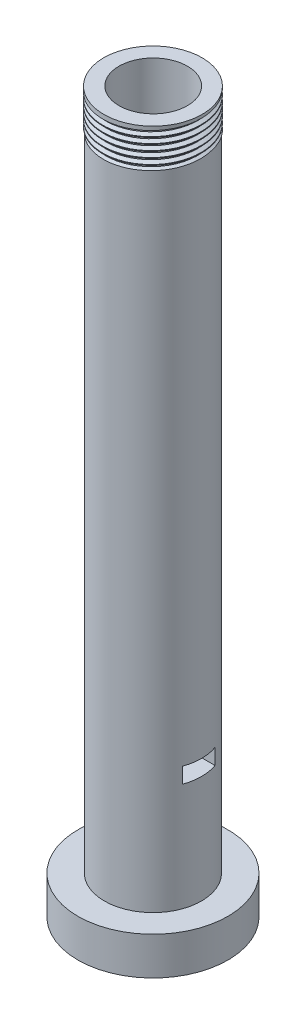
from build123d import *

# Parameters (mm, degrees)
SKETCH2_R                           = 8
CUT_EXTRUDE1_DEPTH                  = 134.061937
THREAD5_PITCH                       = 1.411111111
CUT_EXTRUDE2_REACH                  = 89.654
CUT_EXTRUDE2_END_RADIUS             = 11.342749312
SKETCH20_W                          = 7.627140327
SKETCH20_H                          = 3.651585578
CUT_EXTRUDE2_DIRECTION_2_REACH      = 89.654
CUT_EXTRUDE2_DIRECTION_2_END_RADIUS = 11.342749312


with BuildPart() as part:
    # Sketch1 → Revolve1 (revolve)
    with BuildSketch(Plane(origin=(0, 0, 0), x_dir=(0, 0, -1), z_dir=(1, 0, 0)), mode=Mode.PRIVATE) as revolve1_sk:
        Polygon((11.420216293, 84.061936747), (-0.062793185, 84.061936747), (-0.062793185, 75.199707513), (11.279956127, 75.199707513), (11.420216293, 75.199707513), align=None)
        Polygon((11.279956127, 75.199707513), (-0.062793185, 75.199707513), (-0.062793185, 50), (7.937206815, 50), (7.937206815, -50), (-0.062793185, -50), (-0.062793185, -75.199707513), (11.279956127, -75.199707513), align=None)
        Polygon((11.279956127, -75.199707513), (-0.062793185, -75.199707513), (-0.062793185, -84.061936747), (17.467418115, -84.061936747), (17.467418115, -75.199707513), align=None)
    revolve(revolve1_sk.sketch.rotate(Axis((0, 84.061936747, 0.062793185), (0, -1, 0)), 180), axis=Axis((0, 84.061936747, 0.062793185), (0, -1, 0)))

    # Sketch2 → Cut-Extrude1 (cut)
    with BuildSketch(Plane(origin=(0, 84.061936747, 0), x_dir=(1, 0, 0), z_dir=(0, 1, 0))):
        with Locations(Location((0, 0, 0), (0, 0, 270))):
            Circle(SKETCH2_R)
    extrude(amount=-CUT_EXTRUDE1_DEPTH, mode=Mode.SUBTRACT)

    # Thread5: the profile of Thread Profile5 profile screwed along a right-hand helix of 6.28032 turns, 8 arcs to a turn; built about Z, then put on its axis
    thread5_z = Axis((0, 0, 0), (0, 0, 1))
    thread5_corners = [(11.483309478, 0, -0.000173205), (11.483309478, 0, 1.234895424), (10.719223188, 0, 0.793749998), (10.719223188, 0, 0.44097222)]
    with BuildLine(mode=Mode.PRIVATE) as thread5_profile:
        Line(thread5_corners[0], thread5_corners[1])
        Line(thread5_corners[1], thread5_corners[2])
        Line(thread5_corners[2], thread5_corners[3])
        Line(thread5_corners[3], thread5_corners[0])
    thread5_cap = Face(thread5_profile.wire())
    thread5_turn_angles = [0, 22.5, 45, 67.5, 90, 112.5, 135, 157.5, 180, 202.5, 225, 247.5, 270, 292.5, 315, 337.5, 360]
    thread5_turn_weights = [1, 0.9238795325112867, 1, 0.9238795325112867, 1, 0.9238795325112867, 1, 0.9238795325112867, 1, 0.9238795325112867, 1, 0.9238795325112867, 1, 0.9238795325112867, 1, 0.9238795325112867, 1]
    thread5_turn_rails = [Edge.make_bspline([Vector(p[0], p[1], 0).rotate(thread5_z, thread5_turn_angles[k]) / thread5_turn_weights[k] + Vector(0, 0, p[2] + THREAD5_PITCH * thread5_turn_angles[k] / 360) for k in range(17)], [0, 0, 0, 1, 1, 2, 2, 3, 3, 4, 4, 5, 5, 6, 6, 7, 7, 8, 8, 8], 2, thread5_turn_weights) for p in thread5_corners]
    thread5_turn_sides = [Face.make_surface_from_curves(thread5_turn_rails[p[0]], thread5_turn_rails[p[1]]) for p in [(0, 1), (1, 2), (2, 3), (3, 0)]]
    thread5_last_angles = [2160, 2182.5, 2205, 2227.5, 2250, 2255.457587266, 2260.915174533]
    thread5_last_weights = [1, 0.9238795325112867, 1, 0.9238795325112867, 1, 0.9954668746800583, 1]
    thread5_last_rails = [Edge.make_bspline([Vector(p[0], p[1], 0).rotate(thread5_z, thread5_last_angles[k]) / thread5_last_weights[k] + Vector(0, 0, p[2] + THREAD5_PITCH * thread5_last_angles[k] / 360) for k in range(7)], [0, 0, 0, 1, 1, 2, 2, 3, 3, 3], 2, thread5_last_weights) for p in thread5_corners]
    thread5_last_sides = [Face.make_surface_from_curves(thread5_last_rails[p[0]], thread5_last_rails[p[1]]) for p in [(0, 1), (1, 2), (2, 3), (3, 0)]]
    thread5 = Plane(origin=(0, 84.061936747, 0.062793185), x_dir=(-1, 0, 0), z_dir=(0, -1, 0)) * Solid(Shell([*[p.moved(Location((0, 0, THREAD5_PITCH * i))) for i in range(6) for p in thread5_turn_sides], *thread5_last_sides, thread5_cap, thread5_cap.rotate(thread5_z, 2260.915174533).moved(Location((0, 0, THREAD5_PITCH * 2260.915174533 / 360)))]))
    add(thread5, mode=Mode.SUBTRACT)

    # Cut-Extrude2: up to this cylinder (the profile starts inside it)
    cut_extrude2_end = Plane(origin=(0, -48.174207, 0.062793185), z_dir=(0, 1, 0)) * Cylinder(CUT_EXTRUDE2_END_RADIUS, 202.993498624, mode=Mode.PRIVATE)
    # Sketch20 → Cut-Extrude2 (cut, up to the surface)
    with BuildSketch(Plane(origin=(0, 0, 0), x_dir=(0, 0, -1), z_dir=(1, 0, 0)), mode=Mode.PRIVATE) as cut_extrude2_sk1:
        with Locations((-0.062793186, -48.174207211)):
            Rectangle(SKETCH20_W, SKETCH20_H)
    cut_extrude2_tool1 = extrude(cut_extrude2_sk1.sketch, amount=-CUT_EXTRUDE2_REACH, mode=Mode.PRIVATE) & cut_extrude2_end
    add(cut_extrude2_tool1.solids().sort_by_distance((0, -48.174207, 0.062793))[0], mode=Mode.SUBTRACT)

    # Cut-Extrude2 direction 2: up to this cylinder (the profile starts inside it)
    cut_extrude2_direction_2_end = Plane(origin=(0, -48.174207, 0.062793185), z_dir=(0, 1, 0)) * Cylinder(CUT_EXTRUDE2_DIRECTION_2_END_RADIUS, 202.993498624, mode=Mode.PRIVATE)
    # Sketch20 → Cut-Extrude2 direction 2 (cut, up to the surface)
    with BuildSketch(Plane(origin=(0, 0, 0), x_dir=(0, 0, -1), z_dir=(1, 0, 0)), mode=Mode.PRIVATE) as cut_extrude2_direction_2_sk1:
        with Locations((-0.062793186, -48.174207211)):
            Rectangle(SKETCH20_W, SKETCH20_H)
    cut_extrude2_direction_2_tool1 = extrude(cut_extrude2_direction_2_sk1.sketch, amount=CUT_EXTRUDE2_DIRECTION_2_REACH, mode=Mode.PRIVATE) & cut_extrude2_direction_2_end
    add(cut_extrude2_direction_2_tool1.solids().sort_by_distance((0, -48.174207, 0.062793))[0], mode=Mode.SUBTRACT)


solid = part.part
